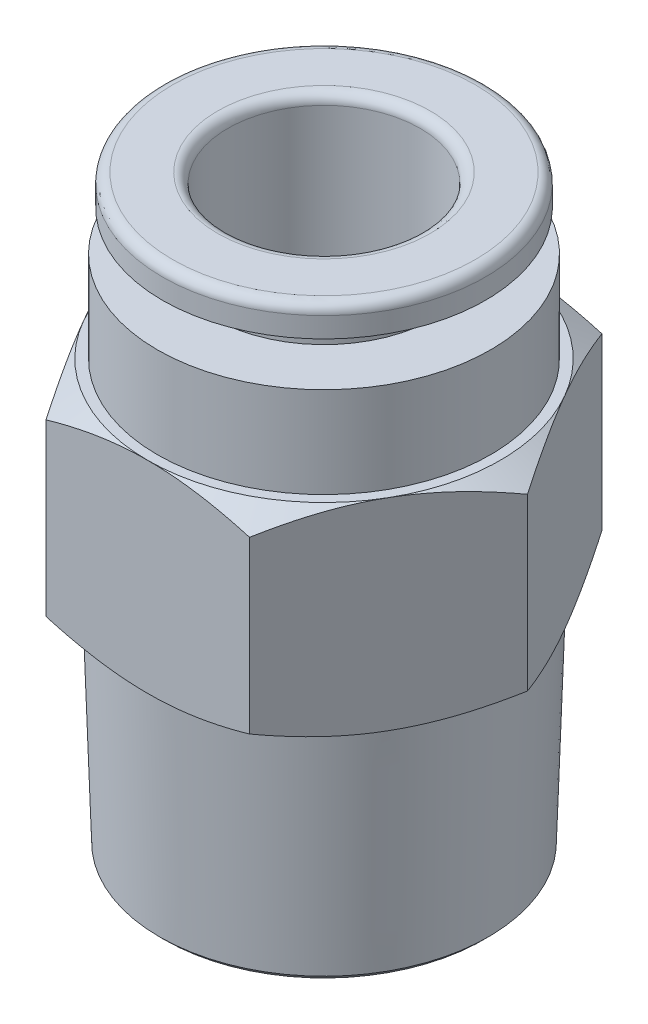
from build123d import *

# Parameters (mm, degrees)
UBODY_SKETCH_R = 8.25
UBODY_DEPTH    = 4.5
NUT_DEPTH      = 10
UTUBE_START    = -21
UTUBE_SKETCH_R = 4.765
UTUBE_DEPTH    = 21
UTUBE_RADIUS_R = 0.5
PORT_SKETCH_R  = 4.23
PORT_DEPTH     = 32.919118096


with BuildPart() as part:
    # URelease_Sketch → URelease (revolve)
    with BuildSketch(Plane.XY, mode=Mode.PRIVATE) as urelease_sk:
        with BuildLine():
            Line((0, 0), (-7.5, 0))
            ThreePointArc((-7.5, 0), (-7.853553391, -0.146446609), (-8, -0.5))
            Line((-8, -0.5), (-8, -1.5))
            Line((-8, -1.5), (-5.515, -1.5))
            Line((-5.515, -1.5), (-5.515, -3.5))
            Line((-5.515, -3.5), (0, -3.5))
            Line((0, -3.5), (0, 0))
        make_face()
    revolve(urelease_sk.sketch.rotate(Axis((0, 0, 0), (0, -1, 0)), 270), axis=Axis((0, 0, 0), (0, -1, 0)))

    # UBody_Sketch → UBody (add)
    with BuildSketch(Plane(origin=(0, -3.5, 0), x_dir=(-1, 0, 0), z_dir=(0, 1, 0))):
        with Locations(Location((0, 0, 0), (0, 0, 90))):
            Circle(UBODY_SKETCH_R)
    extrude(amount=-UBODY_DEPTH)

    # Nut_Sketch → Nut (add)
    with BuildSketch(Plane(origin=(0, -8, 0), x_dir=(-1, 0, 0), z_dir=(0, 1, 0))):
        Polygon((-5.04026785, -8.73), (5.04026785, -8.73), (10.0805357, 0), (5.04026785, 8.73), (-5.04026785, 8.73), (-10.0805357, 0), align=None)
    extrude(amount=-NUT_DEPTH)

    # Nut_Chamfer_Sketch → Nut_Chamfer (revolve, cut)
    with BuildSketch(Plane.XY):
        Polygon((-8.73, -8), (-10.0805357, -8), (-10.0805357, -8.77973215), align=None)
        Polygon((-10.0805357, -17.22026785), (-10.0805357, -18), (-8.73, -18), align=None)
    revolve(axis=Axis((0, 0, 0), (0, -1, 0)), mode=Mode.SUBTRACT)

    # Threads_Sketch → Threads (revolve)
    with BuildSketch(Plane.XY, mode=Mode.PRIVATE) as threads_sk:
        Polygon((0, -18), (-8.475832341, -18), (-8.133218201, -29), (0, -29), align=None)
    revolve(threads_sk.sketch.rotate(Axis((0, 0, 0), (0, -1, 0)), 270), axis=Axis((0, 0, 0), (0, -1, 0)))

    # Thread_Chamfer: read off the stored shape, not the designer's step
    # Thread_Chamfer outline → Thread_Chamfer (revolve, cut)
    with BuildSketch(Plane.XY):
        Polygon((8.141255213, -28.741962988), (7.883218201, -29), (8.141255213, -29), align=None)
    revolve(axis=Axis((0, 0, 0), (0, 1, 0)), mode=Mode.SUBTRACT)

    # UTube_Sketch → UTube (cut)
    with BuildSketch(Plane(origin=(0, 0, 0), x_dir=(1, 0, 0), z_dir=(0, 1, 0)).offset(UTUBE_START)):
        with Locations(Location((0, 0, 0), (0, 0, 270))):
            Circle(UTUBE_SKETCH_R)
    extrude(amount=UTUBE_DEPTH, mode=Mode.SUBTRACT)

    # UTube_Radius
    utube_radius_edges = [part.edges().sort_by_distance(p)[0] for p in [
        (0, 0, -4.765),
    ]]
    fillet(utube_radius_edges, radius=UTUBE_RADIUS_R)

    # Port_Sketch → Port (cut, through all)
    with BuildSketch(Plane(origin=(0, 0, 0), x_dir=(1, 0, 0), z_dir=(0, 1, 0))):
        with Locations(Location((0, 0, 0), (0, 0, 270))):
            Circle(PORT_SKETCH_R)
    extrude(amount=-PORT_DEPTH, mode=Mode.SUBTRACT)


solid = part.part
